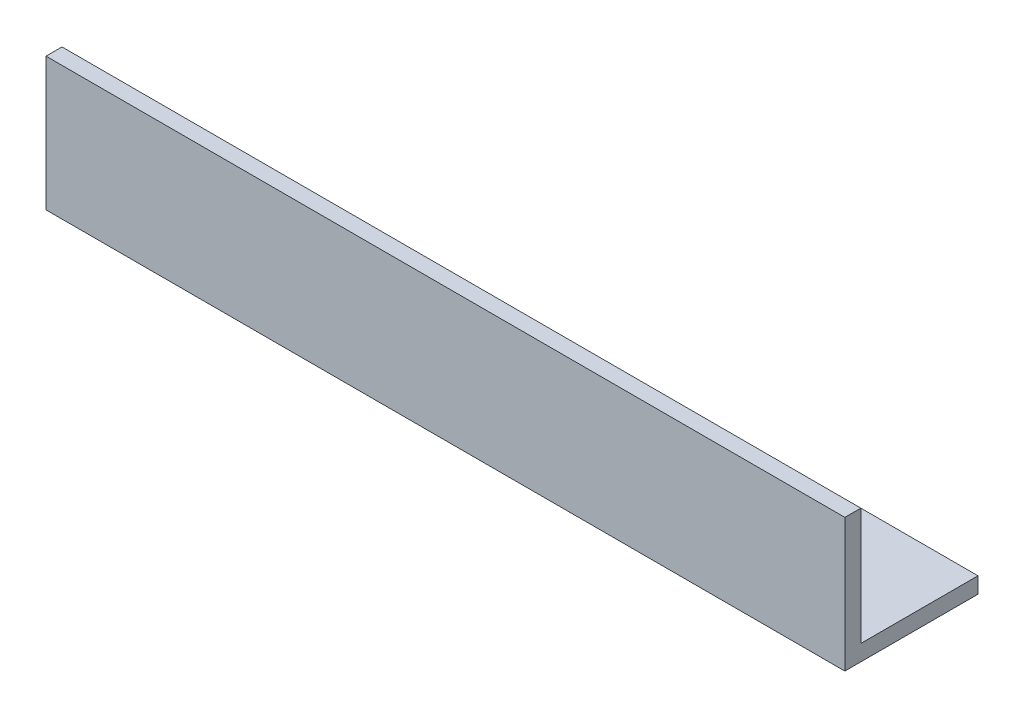
from build123d import *

# Parameters (mm, degrees)
EXTRUDE_1_DEPTH = 300


with BuildPart() as part:
    # Эскиз1 → Вытянуть-Тонкостенный1 (new body)
    with BuildSketch(Plane(origin=(0, 0, 0), x_dir=(0, 0, -1), z_dir=(1, 0, 0))):
        Polygon((0, 50), (0, 0), (50, 0), (50, 6), (6, 6), (6, 50), align=None)
    extrude(amount=EXTRUDE_1_DEPTH)


solid = part.part
